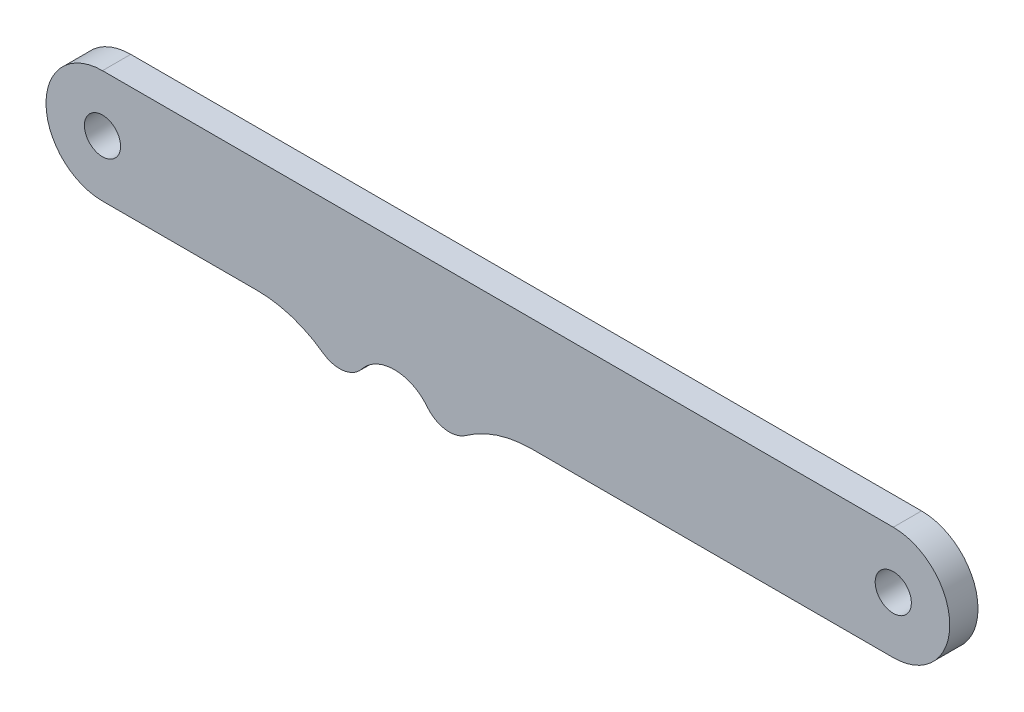
from build123d import *

# Parameters (mm, degrees)
SKETCH1_R           = 2.032
BOSS_EXTRUDE1_DEPTH = 3.175
FILLET1_R           = 3.175


with BuildPart() as part:
    # Sketch1 → Boss-Extrude1 (new body)
    with BuildSketch(Plane.XY):
        with BuildLine():
            Line((0, -6.35), (-40.621541653, -6.35))
            ThreePointArc((-40.621541653, -6.35), (-47.221547182, -8.199657747), (-51.899072183, -13.209854015))
            ThreePointArc((-51.899072183, -13.209854015), (-56.07175848, -6.35), (-60.244444776, -13.209854015))
            ThreePointArc((-60.244444776, -13.209854015), (-64.921969777, -8.199657747), (-71.521975307, -6.35))
            Line((-71.521975307, -6.35), (-88.9, -6.35))
            ThreePointArc((-88.9, -6.35), (-95.25, 0), (-88.9, 6.35))
            Line((-88.9, 6.35), (0, 6.35))
            ThreePointArc((0, 6.35), (6.35, 0), (0, -6.35))
        make_face()
        Circle(SKETCH1_R, mode=Mode.SUBTRACT)
        with Locations((-88.9, 0)):
            Circle(SKETCH1_R, mode=Mode.SUBTRACT)
    extrude(amount=BOSS_EXTRUDE1_DEPTH)

    # Fillet1
    fillet1_edges = [part.edges().sort_by_distance(p)[0] for p in [
        (-60.244444776, -13.209854015, 1.5875),
        (-51.899072183, -13.209854015, 1.5875),
    ]]
    fillet(fillet1_edges, radius=FILLET1_R)


solid = part.part
